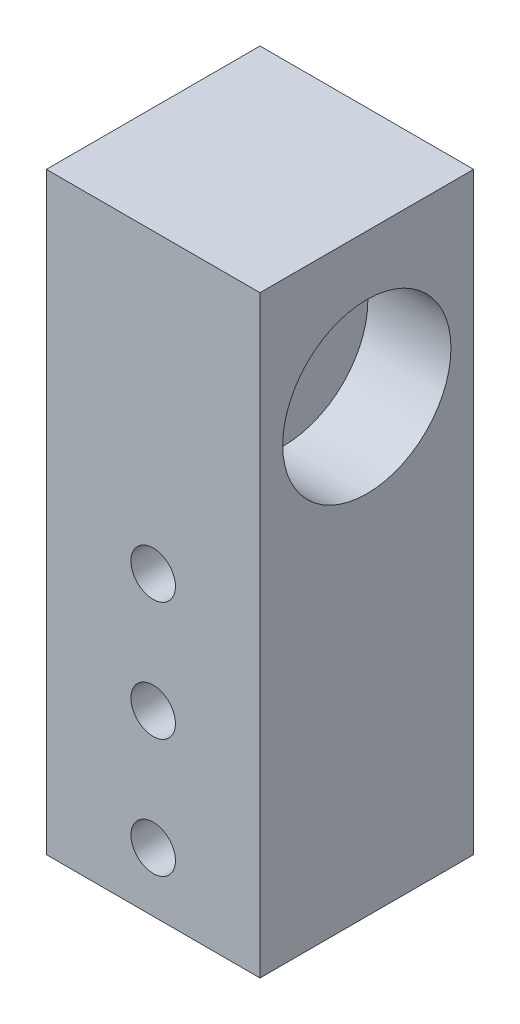
from build123d import *

# Parameters (mm, degrees)
SKETCH1_W           = 45.72
SKETCH1_H           = 76.2
BOSS_EXTRUDE1_DEPTH = 22.86
SKETCH2_R           = 4.7625
CUT_EXTRUDE1_DEPTH  = 100.93536311
SKETCH3_W           = 45.72
SKETCH3_H           = 45.72
BOSS_EXTRUDE2_DEPTH = 50.8
SKETCH4_R           = 17.999964
CUT_EXTRUDE2_DEPTH  = 17.78
SKETCH5_R           = 2.999994
CUT_EXTRUDE3_DEPTH  = 133.031144811


with BuildPart() as part:
    # Sketch1 → Boss-Extrude1 (new, symmetric)
    with BuildSketch(Plane.XY):
        with Locations((22.86, 38.1)):
            Rectangle(SKETCH1_W, SKETCH1_H)
    extrude(amount=BOSS_EXTRUDE1_DEPTH, both=True)

    # Sketch2 → Cut-Extrude1 (cut, through all)
    with BuildSketch(Plane.XY.offset(22.86)):
        with Locations((22.86, 12.7)):
            Circle(SKETCH2_R)
        with Locations((22.86, 38.1)):
            Circle(SKETCH2_R)
        with Locations((22.86, 63.5)):
            Circle(SKETCH2_R)
    extrude(amount=-CUT_EXTRUDE1_DEPTH, mode=Mode.SUBTRACT)

    # Sketch3 → Boss-Extrude2 (add)
    with BuildSketch(Plane(origin=(0, 76.2, 0), x_dir=(1, 0, 0), z_dir=(0, 1, 0))):
        with Locations((22.86, 0)):
            Rectangle(SKETCH3_W, SKETCH3_H)
    extrude(amount=BOSS_EXTRUDE2_DEPTH)

    # Sketch4 → Cut-Extrude2 (cut)
    with BuildSketch(Plane(origin=(45.72, 0, 0), x_dir=(0, 0, -1), z_dir=(1, 0, 0))):
        with Locations((0, 96.300036)):
            Circle(SKETCH4_R)
    extrude(amount=-CUT_EXTRUDE2_DEPTH, mode=Mode.SUBTRACT)

    # Sketch5 → Cut-Extrude3 (cut, through all)
    with BuildSketch(Plane(origin=(27.94, 0, 0), x_dir=(0, 0, -1), z_dir=(1, 0, 0))):
        with Locations((0, 96.300036)):
            Circle(SKETCH5_R)
    extrude(amount=-CUT_EXTRUDE3_DEPTH, mode=Mode.SUBTRACT)


solid = part.part
